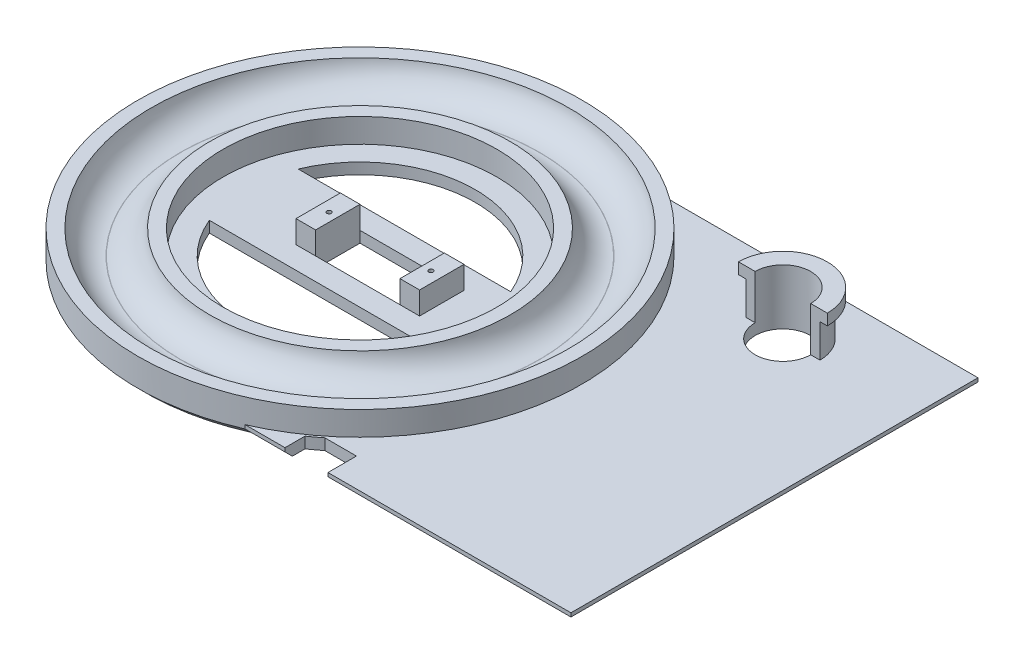
from build123d import *
from build123d.topology import SkipClean

# Parameters (mm, degrees)
SKETCH1_W           = 22.8
SKETCH1_H           = 12
BOSS_EXTRUDE1_DEPTH = 3
SKETCH2_R           = 56.4
SKETCH2_R_2         = 40.6
SKETCH2_R_3         = 37
SKETCH2_W           = 22.8
SKETCH2_H           = 12
BOSS_EXTRUDE2_DEPTH = 6.5
FILLET1_R           = 8
SKETCH3_W           = 5.3
SKETCH3_H           = 12
SKETCH3_R           = 0.6
BOSS_EXTRUDE3_DEPTH = 6.1
CHAMFER1_SIZE       = 2
SKETCH4_W           = 12.561985035
SKETCH4_H           = 13.525375378
CUT_EXTRUDE1_DEPTH  = 1
SKETCH5_R           = 2
CUT_EXTRUDE2_DEPTH  = 4
CUT_EXTRUDE3_DEPTH  = 11.9
SKETCH7_R           = 7.5
CUT_EXTRUDE4_DEPTH  = 10
BOSS_EXTRUDE4_DEPTH = 12
BOSS_EXTRUDE5_DEPTH = 3
CUT_EXTRUDE5_DEPTH  = 12


with BuildPart() as part:
    # Sketch1 → Boss-Extrude1 (new body)
    with BuildSketch(Plane(origin=(0, 0, 0), x_dir=(1, 0, 0), z_dir=(0, 1, 0))):
        with BuildLine():
            Line((112, 55), (112, -55))
            Line((112, -55), (23.979157617, -55))
            ThreePointArc((23.979157617, -55), (-60, 0), (23.979157617, 55))
            Line((23.979157617, 55), (112, 55))
        make_face()
        with Locations((5.4, 0)):
            Rectangle(SKETCH1_W, SKETCH1_H, mode=Mode.SUBTRACT)
    extrude(amount=BOSS_EXTRUDE1_DEPTH)

    # Sketch2 → Boss-Extrude2 (add)
    # profile 1 of 4: a face of its own
    with SkipClean():  # the faces are left unmerged after this step: merging them gives an invalid solid
        with BuildSketch(Plane(origin=(0, 3, 0), x_dir=(1, 0, 0), z_dir=(0, 1, 0))):
            with BuildLine():
                ThreePointArc((23.979157617, -55), (50.193373352, -32.872865277), (60, 0))
                ThreePointArc((60, 0), (50.193373352, 32.872865277), (23.979157617, 55))
                ThreePointArc((23.979157617, 55), (-60, 0), (23.979157617, -55))
            make_face()
            with Locations(Location((0, 0, 0), (0, 0, 90))):
                Circle(SKETCH2_R, mode=Mode.SUBTRACT)
        # profile 2 of 4: a face of its own
        with BuildSketch(Plane(origin=(0, 3, 0), x_dir=(1, 0, 0), z_dir=(0, 1, 0))):
            with Locations(Location((0, 0, 0), (0, 0, 90))):
                Circle(SKETCH2_R_2)
            with Locations(Location((0, 0, 0), (0, 0, 90))):
                Circle(SKETCH2_R_3, mode=Mode.SUBTRACT)
        # profile 3 of 4: a face of its own
        with BuildSketch(Plane(origin=(0, 3, 0), x_dir=(1, 0, 0), z_dir=(0, 1, 0))):
            with Locations((5.4, 0)):
                Rectangle(SKETCH2_W, SKETCH2_H)
        # profile 4 of 4: a face of its own
        with BuildSketch(Plane(origin=(0, 3, 0), x_dir=(1, 0, 0), z_dir=(0, 1, 0))):
            with Locations((5.4, 0)):
                Rectangle(SKETCH2_W, SKETCH2_H)
        extrude(amount=BOSS_EXTRUDE2_DEPTH)


with BuildPart() as boss_extrude2_kept_piece:
    # of the separate pieces the step leaves, the one the design keeps (boss_extrude2_pieces_kept)
    add(part.part.solids().sort_by_distance((23.979157617, 0, -55))[0])

    # Fillet1
    # the kernel refuses this fillet: 8 mm, written as the material it adds along each edge
    with BuildSketch(Plane(origin=(0, 3, 0), x_dir=(0, 0, -1), z_dir=(1, 0, 0))) as fillet1_piece_1:
        with BuildLine():
            CenterArc((48.541883177, 8), FILLET1_R, 270, 79.193077125)
            Line((48.541883177, 0), (48.541883177, -0.16))
            Line((48.541883177, -0.16), (56.4, -0.16))
            Line((56.4, -0.16), (56.56, 0))
            ThreePointArc((56.56, 0), (56.56, 3.25), (56.557162336, 6.47))
            Line((56.557162336, 6.47), (56.4, 6.5))
        make_face()
    revolve(axis=Axis((0, 3, 0), (0, 1, 0)))
    with BuildSketch(Plane(origin=(0, 3, 0), x_dir=(0, 0, -1), z_dir=(1, 0, 0))) as fillet1_piece_2:
        with BuildLine():
            CenterArc((48.458116823, 8), FILLET1_R, 190.806922875, 79.193077125)
            Line((40.6, 6.5), (40.442837664, 6.47))
            ThreePointArc((40.442837664, 6.47), (40.44, 3.25), (40.44, 0))
            Line((40.44, 0), (40.6, -0.16))
            Line((40.6, -0.16), (48.458116823, -0.16))
            Line((48.458116823, -0.16), (48.458116823, 0))
        make_face()
    revolve(axis=Axis((0, 3, 0), (0, 1, 0)))

    # Sketch3 → Boss-Extrude3 (add)
    # profile 1 of 2: a face of its own
    with BuildSketch(Plane(origin=(0, 3, 0), x_dir=(1, 0, 0), z_dir=(0, 1, 0))):
        with Locations((-8.65, 0)):
            Rectangle(SKETCH3_W, SKETCH3_H)
        with Locations(Location((-8.35, 0, 0), (0, 0, 270))):
            Circle(SKETCH3_R, mode=Mode.SUBTRACT)
    # profile 2 of 2: a face of its own
    with BuildSketch(Plane(origin=(0, 3, 0), x_dir=(1, 0, 0), z_dir=(0, 1, 0))):
        with Locations((19.45, 0)):
            Rectangle(SKETCH3_W, SKETCH3_H)
        with Locations(Location((19.156, 0, 0), (0, 0, 270))):
            Circle(SKETCH3_R, mode=Mode.SUBTRACT)
    extrude(amount=BOSS_EXTRUDE3_DEPTH)

    # Chamfer1
    chamfer1_edges = [boss_extrude2_kept_piece.edges().sort_by_distance(p)[0] for p in [
        (112, 0, 0),
        (67.989578808, 0, 55),
        (-60, 0, 0),
        (67.989578808, 0, -55),
    ]]
    chamfer(chamfer1_edges, length=CHAMFER1_SIZE)

    # Sketch4 → Cut-Extrude1 (cut)
    with SkipClean():  # the faces are left unmerged after this step: merging them gives an invalid solid
        with BuildSketch(Plane.XZ):
            with Locations((68.298400031, 49.537890064)):
                Rectangle(SKETCH4_W, SKETCH4_H)
        extrude(amount=-CUT_EXTRUDE1_DEPTH, mode=Mode.SUBTRACT)

    # Sketch5 → Cut-Extrude2 (cut)
    with SkipClean():  # the faces are left unmerged after this step: merging them gives an invalid solid
        with BuildSketch(Plane.XZ):
            with Locations(Location((-39.5, 0, 0), (0, 0, 270))):
                Circle(SKETCH5_R)
            with Locations(Location((19.75, 34.208003449, 0), (0, 0, 270))):
                Circle(SKETCH5_R)
            with Locations(Location((19.75, -34.208003449, 0), (0, 0, 270))):
                Circle(SKETCH5_R)
        extrude(amount=-CUT_EXTRUDE2_DEPTH, mode=Mode.SUBTRACT)

    # Sketch6 → Cut-Extrude3 (cut)
    with SkipClean():  # the faces are left unmerged after this step: merging them gives an invalid solid
        with BuildSketch(Plane(origin=(0, 3, 0), x_dir=(1, 0, 0), z_dir=(0, 1, 0))):
            with BuildLine():
                Line((-28.714918284, 12), (0, 12))
                Line((0, 12), (28.714918284, 12))
                ThreePointArc((28.714918284, 12), (0, 31.121480236), (-28.714918284, 12))
            make_face()
            with BuildLine():
                Line((28.714918284, -12), (-28.714918284, -12))
                ThreePointArc((-28.714918284, -12), (0, -31.121480236), (28.714918284, -12))
            make_face()
        extrude(amount=-CUT_EXTRUDE3_DEPTH, mode=Mode.SUBTRACT)

    # Sketch7 → Cut-Extrude4 (cut)
    with SkipClean():  # the faces are left unmerged after this step: merging them gives an invalid solid
        with BuildSketch(Plane(origin=(0, 3, 0), x_dir=(1, 0, 0), z_dir=(0, 1, 0))):
            with Locations(Location((76.511791502, 37.774024263, 0), (0, 0, 270))):
                Circle(SKETCH7_R)
        extrude(amount=-CUT_EXTRUDE4_DEPTH, mode=Mode.SUBTRACT)

    # Sketch7<3> → Boss-Extrude4 (add)
    with SkipClean():  # the faces are left unmerged after this step: merging them gives an invalid solid
        with BuildSketch(Plane(origin=(0, 3, 0), x_dir=(1, 0, 0), z_dir=(0, 1, 0))):
            with BuildLine():
                Line((66.511791502, 37.774024263), (69.011791502, 37.774024263))
                ThreePointArc((69.011791502, 37.774024263), (76.511791502, 45.274024263), (84.011791502, 37.774024263))
                Line((84.011791502, 37.774024263), (86.511791502, 37.774024263))
                ThreePointArc((86.511791502, 37.774024263), (76.511791502, 47.774024263), (66.511791502, 37.774024263))
            make_face()
        extrude(amount=BOSS_EXTRUDE4_DEPTH)

    # Sketch8 → Boss-Extrude5 (add)
    with SkipClean():  # the faces are left unmerged after this step: merging them gives an invalid solid
        with BuildSketch(Plane(origin=(0, 15, 0), x_dir=(1, 0, 0), z_dir=(0, 1, 0))):
            with BuildLine():
                Line((64.511791502, 37.774024263), (66.511791502, 37.774024263))
                ThreePointArc((66.511791502, 37.774024263), (76.511791502, 47.774024263), (86.511791502, 37.774024263))
                Line((86.511791502, 37.774024263), (88.511791502, 37.774024263))
                ThreePointArc((88.511791502, 37.774024263), (76.511791502, 49.774024263), (64.511791502, 37.774024263))
            make_face()
        extrude(amount=-BOSS_EXTRUDE5_DEPTH)

    # Sketch9 → Cut-Extrude5 (cut)
    with SkipClean():  # the faces are left unmerged after this step: merging them gives an invalid solid
        with BuildSketch(Plane(origin=(0, 3, 0), x_dir=(1, 0, 0), z_dir=(0, 1, 0))):
            with BuildLine():
                Line((34.719854758, -55), (46.340443844, -55))
                Line((46.340443844, -55), (46.340443844, -47.3))
                Line((46.340443844, -47.3), (37.77394627, -47.3))
                ThreePointArc((37.77394627, -47.3), (36.264905061, -48.466665635), (34.719854758, -49.585206487))
                Line((34.719854758, -49.585206487), (34.719854758, -55))
            make_face()
        extrude(amount=-CUT_EXTRUDE5_DEPTH, mode=Mode.SUBTRACT)


solid = boss_extrude2_kept_piece.part
